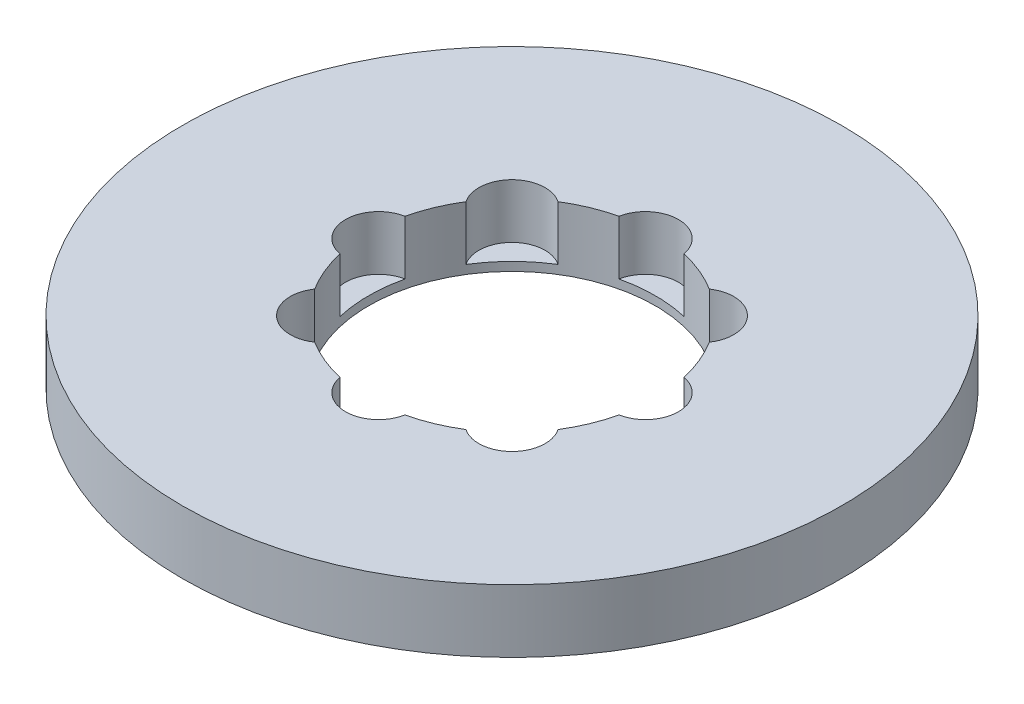
from build123d import *

# Parameters (mm, degrees)
SKETCH1_R           = 57.5
BOSS_EXTRUDE1_DEPTH = 11
SKETCH2_R           = 25
CUT_EXTRUDE1_DEPTH  = 83.057906383
SKETCH3_R           = 5.776880647
CUT_EXTRUDE2_DEPTH  = 9.480654172
CIRPATTERN1_COUNT   = 8


with BuildPart() as part:
    # Sketch1 → Boss-Extrude1 (new body)
    with BuildSketch(Plane(origin=(0, 0, 0), x_dir=(1, 0, 0), z_dir=(0, 1, 0))):
        Circle(SKETCH1_R)
    extrude(amount=BOSS_EXTRUDE1_DEPTH)

    # Sketch2 → Cut-Extrude1 (cut, through all)
    with BuildSketch(Plane(origin=(0, 0, 0), x_dir=(1, 0, 0), z_dir=(0, 1, 0))):
        Circle(SKETCH2_R)
    extrude(amount=CUT_EXTRUDE1_DEPTH, mode=Mode.SUBTRACT)

    # Sketch3 → Cut-Extrude2 (cut)
    with BuildSketch(Plane(origin=(0, 11, 0), x_dir=(1, 0, 0), z_dir=(0, 1, 0))):
        with Locations((-23.271457007, 0)):
            Circle(SKETCH3_R)
    cut_extrude2 = extrude(amount=-CUT_EXTRUDE2_DEPTH, mode=Mode.SUBTRACT)

    # CirPattern1: Cut-Extrude2 ×8 about axis
    cirpattern1_axis = Axis((0, 0, 0), (0, 1, 0))
    for i in range(1, CIRPATTERN1_COUNT):
        add(cut_extrude2.rotate(cirpattern1_axis, i * 360 / CIRPATTERN1_COUNT), mode=Mode.SUBTRACT)


solid = part.part
